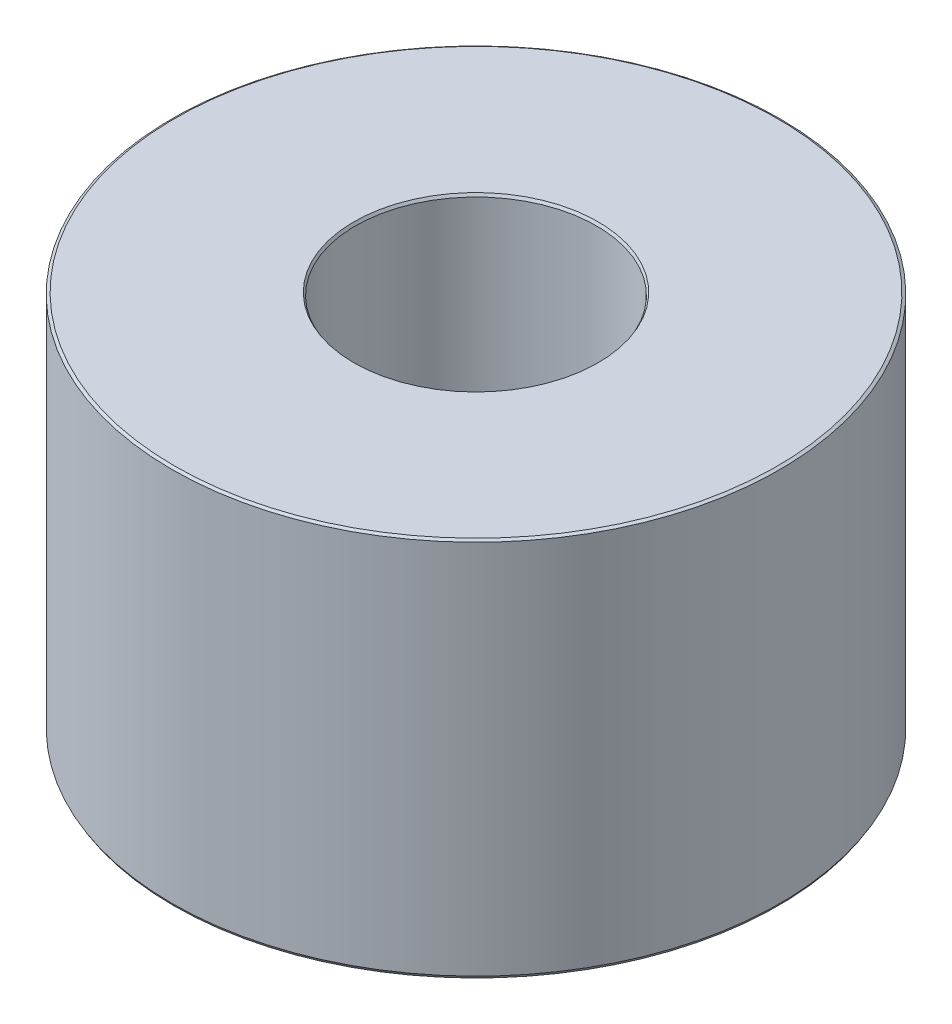
from build123d import *
from OCP.BRepFilletAPI import BRepFilletAPI_MakeChamfer

# Parameters (mm, degrees)
SKETCH1_R           = 42.5
BOSS_EXTRUDE1_DEPTH = 53.153917851
SKETCH2_R           = 16.861212123
CUT_EXTRUDE1_DEPTH  = 81.236145115
CHAMFER1_SIZE       = 0.220773383
CHAMFER1_SIZE2      = 0.382390716


with BuildPart() as part:
    # Sketch1 → Boss-Extrude1 (new body)
    with BuildSketch(Plane(origin=(0, 0, 0), x_dir=(1, 0, 0), z_dir=(0, 1, 0))):
        Circle(SKETCH1_R)
    extrude(amount=BOSS_EXTRUDE1_DEPTH)

    # Sketch2 → Cut-Extrude1 (cut, through all)
    with BuildSketch(Plane(origin=(0, 0, 0), x_dir=(1, 0, 0), z_dir=(0, 1, 0))):
        Circle(SKETCH2_R)
    extrude(amount=CUT_EXTRUDE1_DEPTH, mode=Mode.SUBTRACT)

    # Chamfer1: one chamfer whose edges measure the first distance from different faces: ONE call of the kernel's chamfer builder (chamfer() names one face for all edges)
    chamfer1_edges_1 = [part.edges().sort_by_distance(p)[0] for p in [
        (-16.861212123, 53.153917851, 0),
    ]]
    chamfer1_side_1 = [part.faces().sort_by_distance(p)[0] for p in [
        (-41.297918472, 53.153917851, 0),
    ]]
    chamfer1_edges_2 = [part.edges().sort_by_distance(p)[0] for p in [
        (-16.861212123, 0, 0),
    ]]
    chamfer1_side_2 = [part.faces().sort_by_distance(p)[0] for p in [
        (-16.861212123, 26.576958926, 0),
    ]]
    chamfer1_edges_3 = [part.edges().sort_by_distance(p)[0] for p in [
        (-42.5, 0, 0),
    ]]
    chamfer1_side_3 = [part.faces().sort_by_distance(p)[0] for p in [
        (-41.297918472, 0, 0),
    ]]
    chamfer1_edges_4 = [part.edges().sort_by_distance(p)[0] for p in [
        (-42.5, 53.153917851, 0),
    ]]
    chamfer1_side_4 = [part.faces().sort_by_distance(p)[0] for p in [
        (-42.5, 26.576958926, 0),
    ]]
    chamfer1 = BRepFilletAPI_MakeChamfer(part.part.solid().wrapped)
    for e in chamfer1_edges_1:
        chamfer1.Add(CHAMFER1_SIZE, CHAMFER1_SIZE2, e.wrapped, chamfer1_side_1[0].wrapped)  # the first distance lies on this face
    for e in chamfer1_edges_2:
        chamfer1.Add(CHAMFER1_SIZE, CHAMFER1_SIZE2, e.wrapped, chamfer1_side_2[0].wrapped)  # the first distance lies on this face
    for e in chamfer1_edges_3:
        chamfer1.Add(CHAMFER1_SIZE, CHAMFER1_SIZE2, e.wrapped, chamfer1_side_3[0].wrapped)  # the first distance lies on this face
    for e in chamfer1_edges_4:
        chamfer1.Add(CHAMFER1_SIZE, CHAMFER1_SIZE2, e.wrapped, chamfer1_side_4[0].wrapped)  # the first distance lies on this face
    add(Compound.cast(chamfer1.Shape()), mode=Mode.REPLACE)


solid = part.part
